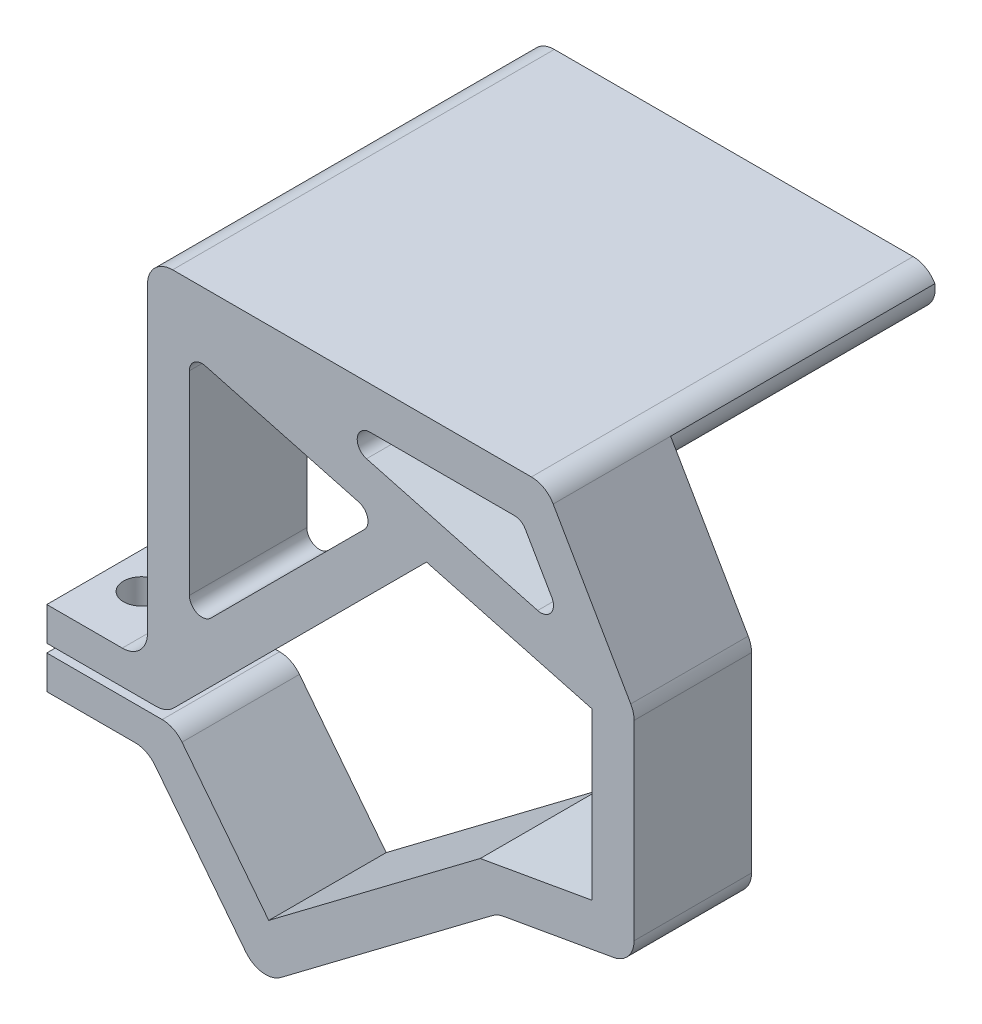
from build123d import *

# Parameters (mm, degrees)
BOSS_EXTRUDE1_DEPTH = 14
FILLET1_R           = 3
SKETCH2_R           = 2.149999998
CUT_EXTRUDE1_DEPTH  = 20
BOSS_EXTRUDE2_START = 31.5
BOSS_EXTRUDE2_DEPTH = 31.5
FILLET2_R           = 3
SKETCH4_W           = 4.998300131
SKETCH4_H           = 5
BOSS_EXTRUDE3_DEPTH = 7
SKETCH5_W           = 10
SKETCH5_H           = 5
BOSS_EXTRUDE4_DEPTH = 4
FILLET3_R           = 1


with BuildPart() as part:
    # Sketch1 → Boss-Extrude1 (new body)
    with BuildSketch(Plane.XY):
        with BuildLine():
            Line((-1.241250307, 13.85672555), (-14.250633986, 13.85672555))
            Line((-14.250633986, 13.85672555), (-14.250633986, 17.85672555))
            Line((-14.250633986, 17.85672555), (-5.250633986, 17.85672555))
            ThreePointArc((-5.250633986, 17.85672555), (-3.129313642, 18.735405207), (-2.250633986, 20.85672555))
            Line((-2.250633986, 20.85672555), (-2.250633986, 59.910721228))
            Line((-2.250633986, 59.910721228), (-0.250633986, 59.910721228))
            Line((-0.250633986, 59.910721228), (45.249366014, 59.910721228))
            Line((45.249366014, 59.910721228), (55.360948415, 42.396946765))
            ThreePointArc((55.360948415, 42.396946765), (55.660649682, 41.673403901), (55.762872203, 40.896946765))
            Line((55.762872203, 40.896946765), (55.762872203, 18.148173952))
            ThreePointArc((55.762872203, 18.148173952), (55.061005533, 16.219811123), (53.283816736, 15.193750693))
            Line((53.283816736, 15.193750693), (40.181909711, 12.883530985))
            ThreePointArc((40.181909711, 12.883530985), (39.506607037, 12.680287949), (38.897409174, 12.325014256))
            Line((38.897409174, 12.325014256), (13.646499049, -6.702911338))
            ThreePointArc((13.646499049, -6.702911338), (11.449475402, -7.281339392), (9.477021718, -6.153989234))
            Line((9.477021718, -6.153989234), (-1.349799491, 7.703709976))
            ThreePointArc((-1.349799491, 7.703709976), (-2.398718311, 8.553107689), (-3.713831752, 8.85672555))
            Line((-3.713831752, 8.85672555), (-14.250633986, 8.85672555))
            Line((-14.250633986, 8.85672555), (-14.250633986, 12.85672555))
            Line((-14.250633986, 12.85672555), (-3.093333978, 12.85672555))
            Line((-3.093333978, 12.85672555), (-0.493883182, 12.85672555))
            ThreePointArc((-0.493883182, 12.85672555), (0.821230258, 12.553107689), (1.870149079, 11.703709976))
            Line((1.870149079, 11.703709976), (12.207057793, -1.526929835))
            Line((12.207057793, -1.526929835), (37.422217436, 17.474055838))
            Line((37.422217436, 17.474055838), (50.762872203, 19.826373214))
            Line((50.762872203, 19.826373214), (50.762872203, 39.578259723))
            Line((50.762872203, 39.578259723), (31.01448812, 44.86982329))
            Line((31.01448812, 44.86982329), (15.607892966, 29.463228136))
            Line((15.607892966, 29.463228136), (0.880070037, 14.735405207))
            ThreePointArc((0.880070037, 14.735405207), (-0.09320001, 14.085086953), (-1.241250307, 13.85672555))
        make_face()
        with BuildLine():
            Line((45.951332722, 48.694879226), (42.79562737, 54.160721228))
            ThreePointArc((42.79562737, 54.160721228), (42.246589264, 54.709759334), (41.496589264, 54.910721228))
            Line((41.496589264, 54.910721228), (24.253494556, 54.910721228))
            ThreePointArc((24.253494556, 54.910721228), (22.766327264, 53.606510517), (23.865265988, 51.961832489))
            Line((23.865265988, 51.961832489), (44.264066048, 46.495990486))
            ThreePointArc((44.264066048, 46.495990486), (45.842324626, 47.031737082), (45.951332722, 48.694879226))
        make_face(mode=Mode.SUBTRACT)
        with BuildLine():
            Line((23.600595455, 44.526998437), (5.310026186, 26.236429168))
            ThreePointArc((5.310026186, 26.236429168), (3.675340866, 25.911270041), (2.749366014, 27.29708934))
            Line((2.749366014, 27.29708934), (2.749366014, 50.488601873))
            ThreePointArc((2.749366014, 50.488601873), (3.336223871, 51.678631883), (4.637594582, 51.937490612))
            Line((4.637594582, 51.937490612), (22.92816385, 47.036547348))
            ThreePointArc((22.92816385, 47.036547348), (23.988824022, 45.975887176), (23.600595455, 44.526998437))
        make_face(mode=Mode.SUBTRACT)
    extrude(amount=-BOSS_EXTRUDE1_DEPTH)

    # Fillet1
    fillet1_edges = [part.edges().sort_by_distance(p)[0] for p in [
        (-2.250633986, 59.910721228, -7),
        (45.249366014, 59.910721228, -7),
    ]]
    fillet(fillet1_edges, radius=FILLET1_R)

    # Sketch2 → Cut-Extrude1 (cut)
    with BuildSketch(Plane.XZ.offset(-8.85672555)):
        with Locations((-9.950633986, -6.999923237)):
            Circle(SKETCH2_R)
    extrude(amount=-CUT_EXTRUDE1_DEPTH, mode=Mode.SUBTRACT)

    # Sketch3 → Boss-Extrude2 (add)
    with BuildSketch(Plane(origin=(0, 0, -14), x_dir=(-1, 0, 0), z_dir=(0, 0, -1)).offset(BOSS_EXTRUDE2_START)):
        with BuildLine():
            Line((-43.517315207, 59.910721228), (-0.749366014, 59.910721228))
            ThreePointArc((-0.749366014, 59.910721228), (1.371954329, 59.032041572), (2.250633986, 56.910721228))
            Line((2.250633986, 56.910721228), (2.250633986, 54.910721228))
            Line((2.250633986, 54.910721228), (-48.13611736, 54.910721228))
            Line((-48.13611736, 54.910721228), (-46.115391418, 58.410721228))
            ThreePointArc((-46.115391418, 58.410721228), (-45.017315207, 59.50879744), (-43.517315207, 59.910721228))
        make_face()
    extrude(amount=-BOSS_EXTRUDE2_DEPTH)

    # Fillet2
    # the kernel refuses this fillet: 3 mm, written as the material it takes off along each edge
    with BuildSketch(Plane(origin=(-2.250633986, 54.910721228, -52.571067812), x_dir=(0, 1, 0), z_dir=(0, 0, 1))) as fillet2_piece_1:
        with BuildLine():
            CenterArc((3, -2.828427125), FILLET2_R, 109.471220634, 70.528779366)
            Line((0, -2.828427125), (-0.06, -2.828427125))
            Line((-0.06, -2.828427125), (-0.06, 0))
            Line((-0.06, 0), (0, 0.06))
            ThreePointArc((0, 0.06), (1, 0.06), (1.98, 0.056568542))
            Line((1.98, 0.056568542), (2, 0))
        make_face()
    extrude(amount=38.571067812, mode=Mode.SUBTRACT)
    with BuildSketch(Plane(origin=(48.13611736, 54.910721228, -57.946914584), x_dir=(-1, 0, 0), z_dir=(0, 0, 1))) as fillet2_piece_2:
        with BuildLine():
            CenterArc((4.978765834, -3), FILLET2_R, 90, 99.594068227)
            Line((2.020725942, -3.5), (1.961565144, -3.51))
            ThreePointArc((1.961565144, -3.51), (0.958401447, -1.78), (-0.051961524, -0.03))
            Line((-0.051961524, -0.03), (0, 0.06))
            Line((0, 0.06), (4.978765834, 0.06))
            Line((4.978765834, 0.06), (4.978765834, 0))
        make_face()
    extrude(amount=43.946914584, mode=Mode.SUBTRACT)

    # Sketch4 → Boss-Extrude3 (add)
    with BuildSketch(Plane(origin=(0, 0, -14), x_dir=(-1, 0, 0), z_dir=(0, 0, -1))):
        with Locations((-0.24851608, 43.455333299)):
            Rectangle(SKETCH4_W, SKETCH4_H)
        Polygon((-9.274118244, 30.200521226), (-5.738584338, 26.66498732), (-9.274118244, 23.129453414), (-12.80965215, 26.66498732), align=None)
    extrude(amount=BOSS_EXTRUDE3_DEPTH)

    # Sketch5 → Boss-Extrude4 (add)
    with BuildSketch(Plane(origin=(0, 0, -21), x_dir=(-1, 0, 0), z_dir=(0, 0, -1))):
        Polygon((-12.80965215, 26.66498732), (-9.274118244, 23.129453414), (-2.203050432, 30.200521226), (-5.738584338, 33.736055132), align=None)
        with Locations((-2.749366014, 43.455333299)):
            Rectangle(SKETCH5_W, SKETCH5_H)
    extrude(amount=BOSS_EXTRUDE4_DEPTH)

    # Fillet3
    fillet3_edges = [part.edges().sort_by_distance(p)[0] for p in [
        (0.248516079, 40.955333299, -14),
        (0.248516079, 45.955333299, -14),
        (2.747666145, 43.455333299, -21),
        (11.041885197, 28.432754273, -14),
        (7.506351291, 24.897220367, -14),
        (7.506351291, 28.432754273, -21),
        (-2.250633986, 43.455333299, -25),
        (11.041885197, 24.897220367, -25),
    ]]
    fillet(fillet3_edges, radius=FILLET3_R)


solid = part.part
